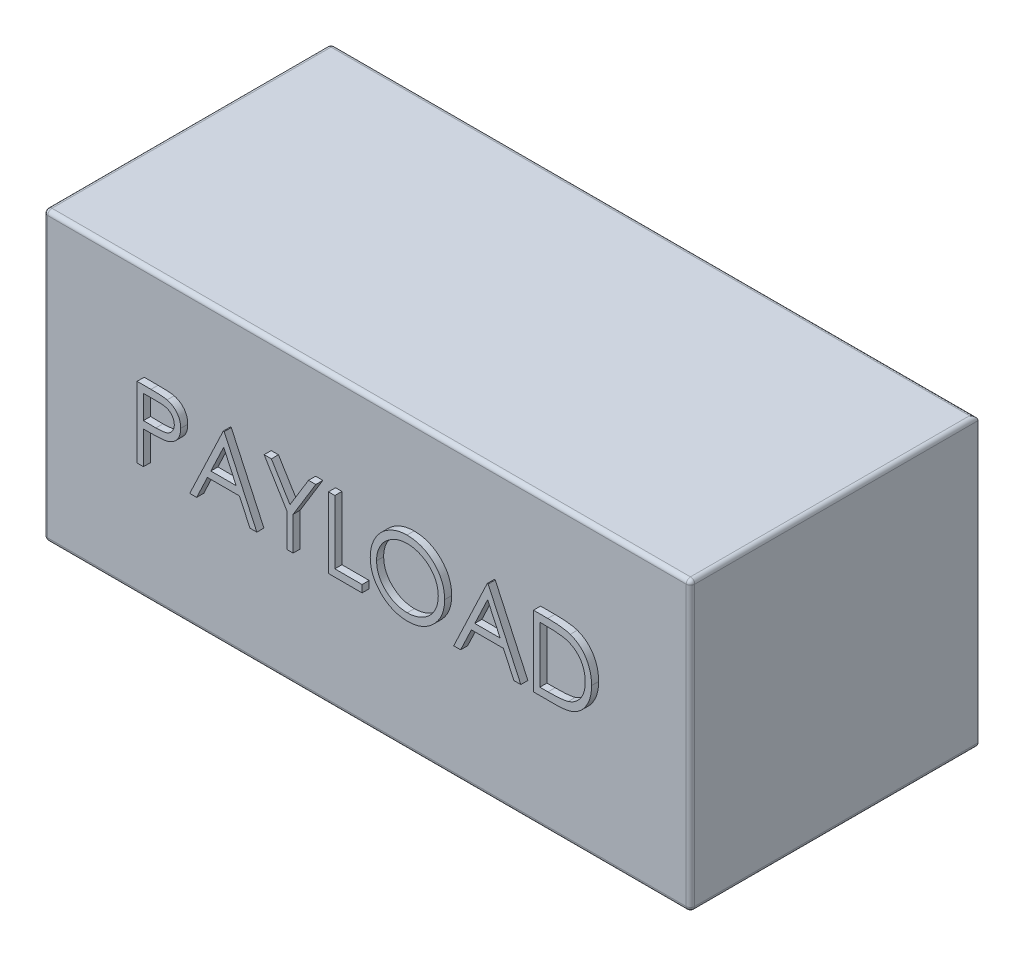
from build123d import *

# Parameters (mm, degrees)
SKETCH1_W           = 457.2
SKETCH1_H           = 203.2
BOSS_EXTRUDE1_DEPTH = 203.2
BOSS_EXTRUDE2_DEPTH = 5
BOSS_EXTRUDE3_DEPTH = 5
FILLET1_R           = 3


with BuildPart() as part:
    # Sketch1 → Boss-Extrude1 (new body)
    with BuildSketch(Plane.XY):
        Rectangle(SKETCH1_W, SKETCH1_H)
    extrude(amount=BOSS_EXTRUDE1_DEPTH)

    # Sketch2 → Boss-Extrude2 (add)
    # profile 1 of 7: a face of its own
    with BuildSketch(Plane.XZ.offset(101.6)):
        with BuildLine():
            Line((-154.356741259, 121.087426038), (-144.551052156, 121.087426038))
            add(Edge.make_bspline(
                [(-144.551052156, 121.087426038), (-143.87661064, 121.086684664), (-142.584350742, 121.085264156), (-140.731278518, 121.042196359), (-139.048282352, 120.984672186), (-137.538991196, 120.904930855), (-136.198761223, 120.810693851), (-135.033656944, 120.67852186), (-134.034520425, 120.540517638), (-133.435856861, 120.400211831), (-133.162831002, 120.336224115)],
                knots=[0, 0, 0, 0, 1.415646017, 2.712440637, 3.8905458, 4.950247383, 5.884950622, 6.709939814, 7.411656543, 8, 8, 8, 8], degree=3))
            add(Edge.make_bspline(
                [(-133.162831002, 120.336224115), (-132.817209091, 120.241624832), (-132.134109417, 120.054655379), (-131.149808801, 119.680173615), (-130.213325294, 119.236142684), (-129.321445888, 118.730086401), (-128.485130415, 118.140292626), (-127.691901258, 117.490669516), (-126.948758683, 116.766218536), (-126.259881656, 115.97506511), (-125.62724169, 115.130490683), (-125.082531937, 114.219887399), (-124.626428694, 113.258583064), (-124.235239101, 112.247246333), (-123.953689752, 111.177384569), (-123.741591184, 110.056431535), (-123.606967933, 108.884507389), (-123.594074193, 108.083652139), (-123.587510489, 107.675967705)],
                knots=[0, 0, 0, 0, 0.999701418, 1.975846123, 2.934577507, 3.890451536, 4.834027766, 5.787354733, 6.749476667, 7.726910423, 8.712836071, 9.690891519, 10.682875813, 11.679750201, 12.712814741, 13.765529915, 14.8625177, 16, 16, 16, 16], degree=3))
            add(Edge.make_bspline(
                [(-123.587510489, 107.675967705), (-123.593530843, 107.264856608), (-123.60531007, 106.46048998), (-123.746685575, 105.283735863), (-123.937116884, 104.159187433), (-124.229931917, 103.08933814), (-124.613441533, 102.080541419), (-125.063328002, 101.117380962), (-125.605949865, 100.216242792), (-126.229447432, 99.373855399), (-126.923041637, 98.58942808), (-127.683797897, 97.868645301), (-128.508644932, 97.215726181), (-129.394961334, 96.629206986), (-130.351387745, 96.122688707), (-131.363418511, 95.669012922), (-132.439850174, 95.28799777), (-133.184743231, 95.087568321), (-133.563472028, 94.985663218)],
                knots=[0, 0, 0, 0, 1.121902311, 2.195077645, 3.232258892, 4.234102512, 5.217864754, 6.176164875, 7.132989551, 8.084763148, 9.034132444, 9.988522005, 10.94243251, 11.903244335, 12.886203696, 13.894208494, 14.929344452, 16, 16, 16, 16], degree=3))
            add(Edge.make_bspline(
                [(-133.563472028, 94.985663218), (-133.876719656, 94.919049202), (-134.563220047, 94.773060715), (-135.693830364, 94.61008276), (-137.01019302, 94.470974178), (-138.510511305, 94.366672213), (-140.193438518, 94.277381235), (-142.059885051, 94.206408465), (-144.113514725, 94.167410553), (-145.545961069, 94.165399227), (-146.293840618, 94.164349115)],
                knots=[0, 0, 0, 0, 0.601384939, 1.31797006, 2.144135048, 3.087295005, 4.142315834, 5.309527816, 6.595305764, 8, 8, 8, 8], degree=3))
            Line((-146.293840618, 94.164349115), (-149.869561771, 94.164349115))
            Line((-149.869561771, 94.164349115), (-149.869561771, 71.087426038))
            Line((-149.869561771, 71.087426038), (-154.356741259, 71.087426038))
            Line((-154.356741259, 71.087426038), (-154.356741259, 121.087426038))
        make_face()
        with BuildLine():
            Line((-149.869561771, 115.95922091), (-149.869561771, 99.292554244))
            Line((-149.869561771, 99.292554244), (-141.115555361, 99.182377961))
            add(Edge.make_bspline(
                [(-141.115555361, 99.182377961), (-140.68812785, 99.182157053), (-139.862987851, 99.181730594), (-138.671041804, 99.238662358), (-137.565194843, 99.304384253), (-136.548843766, 99.400611731), (-135.621530416, 99.536629695), (-134.781708575, 99.673940237), (-134.035890248, 99.872588274), (-133.163044509, 100.14006069), (-132.190425259, 100.596240914), (-131.132317423, 101.2583822), (-130.235594761, 102.102392318), (-129.459619093, 103.051361336), (-128.843820837, 104.107063185), (-128.393020946, 105.236619424), (-128.12814727, 106.428445846), (-128.092630217, 107.243990687), (-128.074689977, 107.655935654)],
                knots=[0, 0, 0, 0, 1.160613943, 2.240541288, 3.23993089, 4.169200891, 5.011653406, 5.7853311, 6.478053781, 7.106038997, 8.262395093, 9.384106736, 10.481365981, 11.59014053, 12.70357646, 13.786202915, 14.881775077, 16, 16, 16, 16], degree=3))
            add(Edge.make_bspline(
                [(-128.074689977, 107.655935654), (-128.092727784, 108.057914417), (-128.128584712, 108.856998448), (-128.395097043, 110.0281236), (-128.842944383, 111.14577652), (-129.463752877, 112.188249167), (-130.21719759, 113.13380351), (-131.092902492, 113.955191039), (-132.088806225, 114.615501078), (-133.015209526, 115.041690816), (-133.838083612, 115.301909037), (-134.552825896, 115.483978186), (-135.359835531, 115.629343989), (-136.259375239, 115.747051172), (-137.244472865, 115.847814904), (-138.32359165, 115.916186007), (-139.492643696, 115.956206811), (-140.30422328, 115.958191886), (-140.724930361, 115.95922091)],
                knots=[0, 0, 0, 0, 1.120700087, 2.227813068, 3.331159281, 4.466773991, 5.599788987, 6.693661531, 7.80175334, 8.91857717, 9.525282508, 10.207424825, 10.974604443, 11.810962634, 12.737642355, 13.736264703, 14.826523623, 16, 16, 16, 16], degree=3))
            Line((-140.724930361, 115.95922091), (-149.869561771, 115.95922091))
        make_face(mode=Mode.SUBTRACT)
    # profile 2 of 7: a face of its own
    with BuildSketch(Plane.XZ.offset(101.6)):
        Polygon((-92.81827972, 121.087426038), (-69.741356643, 71.087426038), (-74.61916113, 71.087426038), (-82.010988053, 87.113067064), (-104.677254079, 87.113067064), (-112.279417541, 71.087426038), (-117.177254079, 71.087426038), (-93.459305361, 121.087426038), align=None)
        Polygon((-93.188872669, 111.34183309), (-102.243359848, 92.241272192), (-84.374770105, 92.241272192), align=None, mode=Mode.SUBTRACT)
    # profile 3 of 7: a face of its own
    with BuildSketch(Plane.XZ.offset(101.6)):
        Polygon((-64.613151515, 121.087426038), (-59.474930361, 121.087426038), (-46.33390472, 99.603051038), (-33.21291113, 121.087426038), (-28.074689977, 121.087426038), (-44.100331002, 94.855454885), (-44.100331002, 71.087426038), (-48.587510489, 71.087426038), (-48.587510489, 94.855454885), align=None)
    # profile 4 of 7: a face of its own
    with BuildSketch(Plane.XZ.offset(101.6)):
        Polygon((-19.100331002, 121.087426038), (-14.613151515, 121.087426038), (-14.613151515, 76.215631167), (4.617617716, 76.215631167), (4.617617716, 71.087426038), (-19.100331002, 71.087426038), align=None)
    # profile 5 of 7: a face of its own
    with BuildSketch(Plane.XZ.offset(101.6)):
        with BuildLine():
            add(Edge.make_bspline(
                [(36.348386947, 122.36947732), (37.274217031, 122.346027615), (39.092623702, 122.299970459), (41.765122241, 121.947411837), (44.316480745, 121.337477695), (46.767482728, 120.525149373), (49.088810964, 119.441515297), (51.297938, 118.131727463), (53.389607626, 116.582063767), (55.335627362, 114.804503383), (57.116440938, 112.870454042), (58.68538217, 110.806483898), (60.00027208, 108.625072436), (61.08006904, 106.332774856), (61.927192036, 103.934775313), (62.511749803, 101.41828956), (62.885151948, 98.799622559), (62.928805911, 97.013524491), (62.950951049, 96.10745809)],
                knots=[0, 0, 0, 0, 1.065120563, 2.091984664, 3.0946048, 4.079830382, 5.057816894, 6.036188127, 7.030412546, 8.04752943, 9.064399622, 10.05169764, 11.02544977, 11.989514704, 12.962713494, 13.945757189, 14.957906945, 16, 16, 16, 16], degree=3))
            add(Edge.make_bspline(
                [(62.950951049, 96.10745809), (62.928809156, 95.208065999), (62.885164919, 93.435259993), (62.51132524, 90.83321079), (61.925025241, 88.331915126), (61.087935724, 85.935548658), (60.013286031, 83.641583461), (58.689640729, 81.456055549), (57.130480576, 79.378248429), (55.35609699, 77.43092464), (53.42179639, 75.645246487), (51.347078292, 74.089262549), (49.178602293, 72.750346483), (46.888463605, 71.682008284), (44.507034508, 70.828123706), (42.013001321, 70.245943277), (39.418050549, 69.870414088), (37.64846478, 69.827292431), (36.749027972, 69.805374756)],
                knots=[0, 0, 0, 0, 1.043624062, 2.057103931, 3.04512605, 4.022047818, 4.998200453, 5.980619268, 6.982898556, 8.009068085, 9.034988726, 10.034168286, 11.015286542, 11.987931943, 12.962482838, 13.94673481, 14.956375938, 16, 16, 16, 16], degree=3))
            add(Edge.make_bspline(
                [(36.749027972, 69.805374756), (35.842966272, 69.827508854), (34.056877473, 69.871141053), (31.434919825, 70.245161122), (28.916666342, 70.83003689), (26.509318467, 71.665885979), (24.211533758, 72.746132132), (22.018818291, 74.063337548), (19.939973331, 75.626296707), (17.992234095, 77.400104916), (16.210102693, 79.331127087), (14.656397326, 81.400187874), (13.338895707, 83.566694398), (12.262276671, 85.836659028), (11.409927252, 88.199108209), (10.82842985, 90.669800745), (10.452201963, 93.234650828), (10.408847014, 94.980977947), (10.386848485, 95.867073474)],
                knots=[0, 0, 0, 0, 1.053102029, 2.075944431, 3.073151272, 4.055350789, 5.033113405, 6.020478099, 7.024410459, 8.052272461, 9.079885166, 10.07527673, 11.055994387, 12.023226415, 12.992069828, 13.970394897, 14.97016774, 16, 16, 16, 16], degree=3))
            add(Edge.make_bspline(
                [(10.386848485, 95.867073474), (10.394486135, 96.461825891), (10.409665083, 97.643827655), (10.592403547, 99.3990648), (10.857570707, 101.126074197), (11.237598029, 102.819944882), (11.734621843, 104.476530378), (12.321079377, 106.107255561), (13.037362882, 107.695594472), (13.847086426, 109.249071496), (14.75082654, 110.743470151), (15.749051532, 112.156035624), (16.806699653, 113.498621293), (17.966176705, 114.736435633), (19.189268779, 115.905487867), (20.495817039, 116.987812396), (21.877849101, 117.993168839), (23.341311669, 118.899173711), (24.850144167, 119.71858992), (26.405526707, 120.42175922), (27.986334871, 121.025274384), (29.599972699, 121.51442903), (31.242155157, 121.900600973), (32.916466365, 122.163563168), (34.621572455, 122.34676771), (35.770305583, 122.361874881), (36.348386947, 122.36947732)],
                knots=[0, 0, 0, 0, 1.037015668, 2.060948919, 3.074880161, 4.083647147, 5.086022904, 6.090072063, 7.104153813, 8.122640571, 9.144368836, 10.147691507, 11.138137339, 12.123020368, 13.103399296, 14.087645067, 15.080126199, 16.082011238, 17.087798457, 18.072939717, 19.057185487, 20.037253025, 21.01195951, 21.997135196, 22.992090687, 24, 24, 24, 24], degree=3))
        make_face()
        with BuildLine():
            add(Edge.make_bspline(
                [(36.568739511, 117.241272192), (36.094244746, 117.235488046), (35.149791418, 117.22397505), (33.745726615, 117.07232197), (32.36012756, 116.856180699), (30.9927081, 116.54787326), (29.649189681, 116.127815363), (28.317049092, 115.644373817), (27.008434037, 115.055501094), (25.727664639, 114.390176746), (24.486020708, 113.653763592), (23.314410688, 112.839881206), (22.209801488, 111.967616145), (21.174897679, 111.034932754), (20.212738076, 110.0370813), (19.304385198, 108.989189355), (18.486248318, 107.861305197), (17.736454363, 106.684013671), (17.065485216, 105.458848225), (16.468837292, 104.198707335), (15.980780023, 102.89331181), (15.582746076, 101.556823845), (15.252748778, 100.191360135), (15.04369272, 98.786562295), (14.890373299, 97.349489266), (14.879518364, 96.378319922), (14.874027972, 95.887105526)],
                knots=[0, 0, 0, 0, 1.008559885, 2.007477868, 2.99961109, 3.989939068, 4.984837346, 5.991145699, 7.001802488, 8.033829008, 9.059044045, 10.069351652, 11.065060232, 12.050310815, 13.029377138, 14.011219647, 14.996725999, 15.989392538, 16.977580475, 17.965360261, 18.951710183, 19.937753436, 20.929683414, 21.935841486, 22.955955122, 24, 24, 24, 24], degree=3))
            add(Edge.make_bspline(
                [(14.874027972, 95.887105526), (14.892240286, 95.164788086), (14.928069541, 93.743766225), (15.241749114, 91.661364169), (15.724920178, 89.660102936), (16.43716827, 87.750932803), (17.327891336, 85.917443048), (18.428275483, 84.175898696), (19.731976705, 82.525829062), (21.212884228, 80.978753791), (22.831780037, 79.566670873), (24.550819036, 78.327193607), (26.351584857, 77.278475752), (28.238773467, 76.424117575), (30.202309739, 75.747121321), (32.254846182, 75.283140876), (34.382709891, 74.977777228), (35.833147822, 74.948452143), (36.568739511, 74.933579885)],
                knots=[0, 0, 0, 0, 1.032063989, 2.030389145, 3.003944642, 3.970395727, 4.937377036, 5.913328081, 6.909231446, 7.93887556, 8.970685674, 9.976071282, 10.964166581, 11.944589148, 12.933237628, 13.927779006, 14.949070134, 16, 16, 16, 16], degree=3))
            add(Edge.make_bspline(
                [(36.568739511, 74.933579885), (37.063160962, 74.940372804), (38.043747196, 74.953845204), (39.502254658, 75.089540587), (40.934486254, 75.307138722), (42.33843311, 75.620433802), (43.712501844, 76.012536751), (45.062427603, 76.478361436), (46.37383175, 77.059521488), (47.663258005, 77.701635082), (48.897490029, 78.433637333), (50.075711919, 79.219896614), (51.168225916, 80.09087691), (52.202355508, 81.009702803), (53.168465351, 81.99490063), (54.060022268, 83.045189513), (54.874024156, 84.167198902), (55.623533394, 85.342704698), (56.292151433, 86.571222594), (56.874709991, 87.835932279), (57.368940217, 89.133719556), (57.767918857, 90.466456291), (58.08056831, 91.831611274), (58.295995737, 93.23101239), (58.446687718, 94.66186014), (58.458045963, 95.629629511), (58.463771562, 96.117474115)],
                knots=[0, 0, 0, 0, 1.047197238, 2.076906641, 3.100256066, 4.114471768, 5.12198147, 6.126382909, 7.136867548, 8.15857795, 9.17633901, 10.174870724, 11.156907918, 12.133735059, 13.104061851, 14.077631395, 15.04955518, 16.038496417, 17.029181396, 18.010275684, 18.986308667, 19.968651475, 20.955262928, 21.950658345, 22.966943676, 24, 24, 24, 24], degree=3))
            add(Edge.make_bspline(
                [(58.463771562, 96.117474115), (58.458041376, 96.601981319), (58.446674498, 97.563090607), (58.296067718, 98.983959441), (58.080340713, 100.373291034), (57.769444883, 101.725631076), (57.368728402, 103.041324292), (56.874623682, 104.319134973), (56.291976546, 105.563823474), (55.623287627, 106.772313431), (54.871633005, 107.931952545), (54.050286672, 109.040558439), (53.145067413, 110.077311886), (52.181838487, 111.067807515), (51.136540125, 111.990920224), (50.013907352, 112.846956233), (48.827569098, 113.656574437), (47.571465735, 114.386939607), (46.275123539, 115.061428645), (44.944924139, 115.639300119), (43.595937002, 116.130330396), (42.23159254, 116.549144182), (40.840407135, 116.854973184), (39.431781009, 117.072516754), (38.007663029, 117.223922266), (37.049902747, 117.235470531), (36.568739511, 117.241272192)],
                knots=[0, 0, 0, 0, 1.02996197, 2.043119294, 3.035359645, 4.018872909, 4.991431989, 5.957985074, 6.929999688, 7.912076566, 8.892894881, 9.867085534, 10.843653904, 11.817741046, 12.803660682, 13.806313499, 14.818574707, 15.856120519, 16.894564902, 17.924820532, 18.937903209, 19.946497019, 20.957711757, 21.963978472, 22.977135795, 24, 24, 24, 24], degree=3))
        make_face(mode=Mode.SUBTRACT)
    # profile 6 of 7: a face of its own
    with BuildSketch(Plane.XZ.offset(101.6)):
        Polygon((93.720181818, 121.087426038), (116.797104895, 71.087426038), (111.919300408, 71.087426038), (104.527473485, 87.113067064), (81.861207459, 87.113067064), (74.259043998, 71.087426038), (69.361207459, 71.087426038), (93.079156177, 121.087426038), align=None)
        Polygon((93.34958887, 111.34183309), (84.29510169, 92.241272192), (102.163691434, 92.241272192), align=None, mode=Mode.SUBTRACT)
    # profile 7 of 7: a face of its own
    with BuildSketch(Plane.XZ.offset(101.6)):
        with BuildLine():
            Line((125.77146387, 71.087426038), (125.77146387, 121.087426038))
            Line((125.77146387, 121.087426038), (135.867617716, 121.087426038))
            add(Edge.make_bspline(
                [(135.867617716, 121.087426038), (136.745746119, 121.08110361), (138.442285623, 121.068888711), (140.893892015, 120.991440266), (143.162231479, 120.854433611), (145.239843752, 120.654868952), (147.132432494, 120.409825615), (148.834698325, 120.102676981), (150.355443223, 119.739988833), (151.290720946, 119.430768115), (151.733002331, 119.284541423)],
                knots=[0, 0, 0, 0, 1.314313732, 2.53924729, 3.670748893, 4.714932338, 5.66265055, 6.526160246, 7.303039223, 8, 8, 8, 8], degree=3))
            add(Edge.make_bspline(
                [(151.733002331, 119.284541423), (152.311498607, 119.064102771), (153.455372782, 118.628224284), (155.084045962, 117.805991408), (156.617265433, 116.874375669), (158.063253217, 115.832149059), (159.388979308, 114.649801223), (160.646234976, 113.377557143), (161.783588173, 111.969152283), (162.825135259, 110.453795311), (163.764216109, 108.849337423), (164.580489792, 107.15883587), (165.258403983, 105.390875755), (165.821164363, 103.550373641), (166.264685185, 101.633282529), (166.567284209, 99.637370157), (166.766869779, 97.570524594), (166.786927655, 96.168032255), (166.797104895, 95.456416423)],
                knots=[0, 0, 0, 0, 0.984719456, 1.947108742, 2.898477687, 3.838006223, 4.779231079, 5.722358779, 6.681677486, 7.655904652, 8.64651281, 9.637519902, 10.640069247, 11.656948941, 12.698408672, 13.768548281, 14.867775369, 16, 16, 16, 16], degree=3))
            add(Edge.make_bspline(
                [(166.797104895, 95.456416423), (166.788119646, 94.83839873), (166.770413273, 93.620530317), (166.611423046, 91.82566038), (166.380332759, 90.084037932), (166.022558505, 88.403956503), (165.588236884, 86.770696247), (165.031606151, 85.201664185), (164.393956206, 83.682466909), (163.650386512, 82.233645824), (162.834081012, 80.86102622), (161.958056109, 79.567090104), (161.023246175, 78.370301221), (160.020737134, 77.267035334), (158.963484041, 76.258955643), (157.844565033, 75.337641138), (156.661092879, 74.521118926), (155.418368269, 73.777303094), (154.080137851, 73.128440873), (152.621054049, 72.579440733), (151.034894363, 72.124489084), (149.325552121, 71.744904859), (147.490073868, 71.443800535), (145.526660071, 71.241994929), (143.438327361, 71.105524462), (142.004337857, 71.093575985), (141.266255536, 71.087426038)],
                knots=[0, 0, 0, 0, 1.105936401, 2.179363191, 3.223086493, 4.248585256, 5.251745608, 6.245858792, 7.225916811, 8.198733463, 9.158002045, 10.082870192, 10.993790845, 11.873723703, 12.748670949, 13.606408763, 14.465103618, 15.319838547, 16.196477973, 17.123216899, 18.106603292, 19.147568657, 20.255746949, 21.433717677, 22.679120308, 24, 24, 24, 24], degree=3))
            Line((141.266255536, 71.087426038), (125.77146387, 71.087426038))
        make_face()
        with BuildLine():
            Line((130.258643357, 76.215631167), (135.997826049, 76.215631167))
            add(Edge.make_bspline(
                [(135.997826049, 76.215631167), (136.82251706, 76.219175401), (138.408699894, 76.22599226), (140.689528427, 76.285809448), (142.773519805, 76.383551412), (144.660969939, 76.520338238), (146.350813143, 76.701318455), (147.846580999, 76.90310278), (149.143370404, 77.154494934), (149.928076646, 77.382365782), (150.290694639, 77.487666423)],
                knots=[0, 0, 0, 0, 1.375205317, 2.645023457, 3.804390687, 4.853969522, 5.800190428, 6.637939096, 7.370582563, 8, 8, 8, 8], degree=3))
            add(Edge.make_bspline(
                [(150.290694639, 77.487666423), (150.747099811, 77.648402969), (151.649008928, 77.966036873), (152.947310145, 78.545432033), (154.158124498, 79.231747315), (155.30255343, 79.994636943), (156.364362794, 80.861008401), (157.356135884, 81.812022526), (158.275875903, 82.852519313), (159.114080303, 83.981207335), (159.864198932, 85.191061559), (160.513787924, 86.470187754), (161.083095518, 87.804570757), (161.529932555, 89.214701595), (161.880155186, 90.687973858), (162.128222157, 92.224491191), (162.282718221, 93.823966646), (162.300738906, 94.911854135), (162.309925408, 95.466432449)],
                knots=[0, 0, 0, 0, 0.998632004, 1.973411704, 2.929992603, 3.868527914, 4.809262121, 5.754881198, 6.702106254, 7.672490631, 8.653608572, 9.636854334, 10.631411391, 11.644891563, 12.686317036, 13.754757253, 14.855430412, 16, 16, 16, 16], degree=3))
            add(Edge.make_bspline(
                [(162.309925408, 95.466432449), (162.302592731, 96.051196453), (162.288187623, 97.199970515), (162.107126046, 98.885551876), (161.842532396, 100.506704027), (161.45990831, 102.063535389), (160.972324326, 103.559083278), (160.363829444, 104.98507628), (159.668592026, 106.356574407), (158.841401499, 107.641922489), (157.935464451, 108.857538334), (156.930066175, 109.971179985), (155.84117991, 110.985384275), (154.680682061, 111.915945884), (153.415866358, 112.725426968), (152.076527918, 113.449522412), (150.643018329, 114.064035146), (149.645694103, 114.390876042), (149.13885169, 114.55697732)],
                knots=[0, 0, 0, 0, 1.122418816, 2.205001699, 3.251619955, 4.274784885, 5.280384055, 6.268708349, 7.249350384, 8.229342522, 9.199999885, 10.157847722, 11.105861043, 12.055065948, 13.010012805, 13.98527497, 14.976112212, 16, 16, 16, 16], degree=3))
            add(Edge.make_bspline(
                [(149.13885169, 114.55697732), (148.719549599, 114.67292629), (147.827998309, 114.919465612), (146.373148823, 115.188399506), (144.735789546, 115.425606634), (142.908650958, 115.626435768), (140.893815828, 115.770540358), (138.689734571, 115.878701996), (136.295454506, 115.951653888), (134.635704023, 115.95663542), (133.774268357, 115.95922091)],
                knots=[0, 0, 0, 0, 0.674548936, 1.434276114, 2.292660221, 3.240891867, 4.284742987, 5.42552168, 6.663806718, 8, 8, 8, 8], degree=3))
            Line((133.774268357, 115.95922091), (130.258643357, 115.95922091))
            Line((130.258643357, 115.95922091), (130.258643357, 76.215631167))
        make_face(mode=Mode.SUBTRACT)
    extrude(amount=BOSS_EXTRUDE2_DEPTH)

    # Sketch3 → Boss-Extrude3 (add)
    # profile 1 of 7: a face of its own
    with BuildSketch(Plane.XY.offset(203.2)):
        with BuildLine():
            Line((-157.444672648, 33.74593702), (-147.638983545, 33.74593702))
            add(Edge.make_bspline(
                [(-147.638983545, 33.74593702), (-146.964542029, 33.745195645), (-145.672282132, 33.743775138), (-143.819209907, 33.700707341), (-142.136213741, 33.643183168), (-140.626922585, 33.563441837), (-139.286692612, 33.469204833), (-138.121588333, 33.337032842), (-137.122451814, 33.19902862), (-136.523788251, 33.058722812), (-136.250762392, 32.994735097)],
                knots=[0, 0, 0, 0, 1.415646017, 2.712440637, 3.8905458, 4.950247383, 5.884950622, 6.709939814, 7.411656543, 8, 8, 8, 8], degree=3))
            add(Edge.make_bspline(
                [(-136.250762392, 32.994735097), (-135.90514048, 32.900135814), (-135.222040806, 32.713166361), (-134.23774019, 32.338684597), (-133.301256683, 31.894653666), (-132.409377277, 31.388597382), (-131.573061805, 30.798803608), (-130.779832648, 30.149180498), (-130.036690072, 29.424729518), (-129.347813045, 28.633576092), (-128.71517308, 27.789001665), (-128.170463327, 26.87839838), (-127.714360083, 25.917094046), (-127.323170491, 24.905757315), (-127.041621141, 23.835895551), (-126.829522574, 22.714942517), (-126.694899322, 21.543018371), (-126.682005583, 20.742163121), (-126.675441879, 20.334478687)],
                knots=[0, 0, 0, 0, 0.999701418, 1.975846123, 2.934577507, 3.890451536, 4.834027766, 5.787354733, 6.749476667, 7.726910423, 8.712836071, 9.690891519, 10.682875813, 11.679750201, 12.712814741, 13.765529915, 14.8625177, 16, 16, 16, 16], degree=3))
            add(Edge.make_bspline(
                [(-126.675441879, 20.334478687), (-126.681462232, 19.92336759), (-126.69324146, 19.119000962), (-126.834616965, 17.942246845), (-127.025048273, 16.817698415), (-127.317863307, 15.747849122), (-127.701372922, 14.739052401), (-128.151259392, 13.775891944), (-128.693881254, 12.874753774), (-129.317378821, 12.03236638), (-130.010973027, 11.247939062), (-130.771729286, 10.527156283), (-131.596576322, 9.874237163), (-132.482892723, 9.287717967), (-133.439319135, 8.781199689), (-134.4513499, 8.327523904), (-135.527781563, 7.946508752), (-136.27267462, 7.746079303), (-136.651403417, 7.6441742)],
                knots=[0, 0, 0, 0, 1.121902311, 2.195077645, 3.232258892, 4.234102512, 5.217864754, 6.176164875, 7.132989551, 8.084763148, 9.034132444, 9.988522005, 10.94243251, 11.903244335, 12.886203696, 13.894208494, 14.929344452, 16, 16, 16, 16], degree=3))
            add(Edge.make_bspline(
                [(-136.651403417, 7.6441742), (-136.964651046, 7.577560184), (-137.651151437, 7.431571696), (-138.781761753, 7.268593741), (-140.09812441, 7.12948516), (-141.598442694, 7.025183195), (-143.281369907, 6.935892217), (-145.14781644, 6.864919447), (-147.201446114, 6.825921535), (-148.633892458, 6.823910209), (-149.381772007, 6.822860097)],
                knots=[0, 0, 0, 0, 0.601384939, 1.31797006, 2.144135048, 3.087295005, 4.142315834, 5.309527816, 6.595305764, 8, 8, 8, 8], degree=3))
            Line((-149.381772007, 6.822860097), (-152.957493161, 6.822860097))
            Line((-152.957493161, 6.822860097), (-152.957493161, -16.25406298))
            Line((-152.957493161, -16.25406298), (-157.444672648, -16.25406298))
            Line((-157.444672648, -16.25406298), (-157.444672648, 33.74593702))
        make_face()
        with BuildLine():
            Line((-152.957493161, 28.617731892), (-152.957493161, 11.951065225))
            Line((-152.957493161, 11.951065225), (-144.203486751, 11.840888943))
            add(Edge.make_bspline(
                [(-144.203486751, 11.840888943), (-143.776059239, 11.840668035), (-142.95091924, 11.840241576), (-141.758973194, 11.89717334), (-140.653126232, 11.962895235), (-139.636775156, 12.059122713), (-138.709461806, 12.195140677), (-137.869639965, 12.332451219), (-137.123821638, 12.531099256), (-136.250975898, 12.798571672), (-135.278356648, 13.254751896), (-134.220248812, 13.916893182), (-133.32352615, 14.760903299), (-132.547550482, 15.709872318), (-131.931752226, 16.765574167), (-131.480952336, 17.895130406), (-131.216078659, 19.086956828), (-131.180561607, 19.902501669), (-131.162621366, 20.314446636)],
                knots=[0, 0, 0, 0, 1.160613943, 2.240541288, 3.23993089, 4.169200891, 5.011653406, 5.7853311, 6.478053781, 7.106038997, 8.262395093, 9.384106736, 10.481365981, 11.59014053, 12.70357646, 13.786202915, 14.881775077, 16, 16, 16, 16], degree=3))
            add(Edge.make_bspline(
                [(-131.162621366, 20.314446636), (-131.180659173, 20.716425399), (-131.216516101, 21.51550943), (-131.483028432, 22.686634581), (-131.930875773, 23.804287501), (-132.551684266, 24.846760149), (-133.30512898, 25.792314492), (-134.180833881, 26.613702021), (-135.176737615, 27.27401206), (-136.103140915, 27.700201798), (-136.926015001, 27.960420018), (-137.640757285, 28.142489168), (-138.447766921, 28.287854971), (-139.347306628, 28.405562154), (-140.332404255, 28.506325886), (-141.411523039, 28.574696989), (-142.580575086, 28.614717793), (-143.392154669, 28.616702868), (-143.812861751, 28.617731892)],
                knots=[0, 0, 0, 0, 1.120700087, 2.227813068, 3.331159281, 4.466773991, 5.599788987, 6.693661531, 7.80175334, 8.91857717, 9.525282508, 10.207424825, 10.974604443, 11.810962634, 12.737642355, 13.736264703, 14.826523623, 16, 16, 16, 16], degree=3))
            Line((-143.812861751, 28.617731892), (-152.957493161, 28.617731892))
        make_face(mode=Mode.SUBTRACT)
    # profile 2 of 7: a face of its own
    with BuildSketch(Plane.XY.offset(203.2)):
        Polygon((-95.90621111, 33.74593702), (-72.829288033, -16.25406298), (-77.70709252, -16.25406298), (-85.098919443, -0.228421954), (-107.765185469, -0.228421954), (-115.36734893, -16.25406298), (-120.265185469, -16.25406298), (-96.547236751, 33.74593702), align=None)
        Polygon((-96.276804058, 24.000344071), (-105.331291238, 4.899783174), (-87.462701494, 4.899783174), align=None, mode=Mode.SUBTRACT)
    # profile 3 of 7: a face of its own
    with BuildSketch(Plane.XY.offset(203.2)):
        Polygon((-67.701082904, 33.74593702), (-62.562861751, 33.74593702), (-49.42183611, 12.26156202), (-36.30084252, 33.74593702), (-31.162621366, 33.74593702), (-47.188262392, 7.513965866), (-47.188262392, -16.25406298), (-51.675441879, -16.25406298), (-51.675441879, 7.513965866), align=None)
    # profile 4 of 7: a face of its own
    with BuildSketch(Plane.XY.offset(203.2)):
        Polygon((-22.188262392, 33.74593702), (-17.701082904, 33.74593702), (-17.701082904, -11.125857852), (1.529686326, -11.125857852), (1.529686326, -16.25406298), (-22.188262392, -16.25406298), align=None)
    # profile 5 of 7: a face of its own
    with BuildSketch(Plane.XY.offset(203.2)):
        with BuildLine():
            add(Edge.make_bspline(
                [(33.260455557, 35.027988302), (34.186285641, 35.004538597), (36.004692312, 34.958481441), (38.677190851, 34.605922819), (41.228549355, 33.995988676), (43.679551338, 33.183660355), (46.000879575, 32.100026278), (48.21000661, 30.790238445), (50.301676237, 29.240574748), (52.247695973, 27.463014365), (54.028509548, 25.528965023), (55.597450781, 23.464994879), (56.912340691, 21.283583418), (57.99213765, 18.991285837), (58.839260646, 16.593286295), (59.423818413, 14.076800541), (59.797220558, 11.45813354), (59.840874521, 9.672035473), (59.86301966, 8.765969071)],
                knots=[0, 0, 0, 0, 1.065120563, 2.091984664, 3.0946048, 4.079830382, 5.057816894, 6.036188127, 7.030412546, 8.04752943, 9.064399622, 10.05169764, 11.02544977, 11.989514704, 12.962713494, 13.945757189, 14.957906945, 16, 16, 16, 16], degree=3))
            add(Edge.make_bspline(
                [(59.86301966, 8.765969071), (59.840877766, 7.866576981), (59.79723353, 6.093770974), (59.423393851, 3.491721772), (58.837093851, 0.990426108), (58.000004334, -1.40594036), (56.925354642, -3.699905557), (55.60170934, -5.885433469), (54.042549187, -7.963240589), (52.2681656, -9.910564378), (50.333865, -11.696242531), (48.259146903, -13.252226469), (46.090670904, -14.591142535), (43.800532216, -15.659480734), (41.419103118, -16.513365312), (38.925069932, -17.095545741), (36.330119159, -17.471074931), (34.560533391, -17.514196587), (33.661096583, -17.536114262)],
                knots=[0, 0, 0, 0, 1.043624062, 2.057103931, 3.04512605, 4.022047818, 4.998200453, 5.980619268, 6.982898556, 8.009068085, 9.034988726, 10.034168286, 11.015286542, 11.987931943, 12.962482838, 13.94673481, 14.956375938, 16, 16, 16, 16], degree=3))
            add(Edge.make_bspline(
                [(33.661096583, -17.536114262), (32.755034883, -17.513980164), (30.968946084, -17.470347965), (28.346988436, -17.096327896), (25.828734952, -16.511452128), (23.421387078, -15.675603039), (21.123602369, -14.595356886), (18.930886902, -13.278151471), (16.852041941, -11.715192311), (14.904302706, -9.941384103), (13.122171303, -8.010361931), (11.568465936, -5.941301144), (10.250964317, -3.774794621), (9.174345282, -1.50482999), (8.321995863, 0.857619191), (7.740498461, 3.328311727), (7.364270574, 5.89316181), (7.320915624, 7.639488929), (7.298917096, 8.525584456)],
                knots=[0, 0, 0, 0, 1.053102029, 2.075944431, 3.073151272, 4.055350789, 5.033113405, 6.020478099, 7.024410459, 8.052272461, 9.079885166, 10.07527673, 11.055994387, 12.023226415, 12.992069828, 13.970394897, 14.97016774, 16, 16, 16, 16], degree=3))
            add(Edge.make_bspline(
                [(7.298917096, 8.525584456), (7.306554746, 9.120336872), (7.321733693, 10.302338637), (7.504472157, 12.057575782), (7.769639317, 13.784585178), (8.149666639, 15.478455864), (8.646690454, 17.135041359), (9.233147988, 18.765766543), (9.949431493, 20.354105453), (10.759155036, 21.907582478), (11.662895151, 23.401981133), (12.661120143, 24.814546606), (13.718768264, 26.157132275), (14.878245316, 27.394946615), (16.10133739, 28.563998849), (17.407885649, 29.646323378), (18.789917711, 30.65167982), (20.25338028, 31.557684693), (21.762212778, 32.377100902), (23.317595318, 33.080270201), (24.898403482, 33.683785366), (26.512041309, 34.172940012), (28.154223768, 34.559111954), (29.828534976, 34.82207415), (31.533641066, 35.005278691), (32.682374193, 35.020385863), (33.260455557, 35.027988302)],
                knots=[0, 0, 0, 0, 1.037015668, 2.060948919, 3.074880161, 4.083647147, 5.086022904, 6.090072063, 7.104153813, 8.122640571, 9.144368836, 10.147691507, 11.138137339, 12.123020368, 13.103399296, 14.087645067, 15.080126199, 16.082011238, 17.087798457, 18.072939717, 19.057185487, 20.037253025, 21.01195951, 21.997135196, 22.992090687, 24, 24, 24, 24], degree=3))
        make_face()
        with BuildLine():
            add(Edge.make_bspline(
                [(33.480808121, 29.899783174), (33.006313356, 29.893999028), (32.061860029, 29.882486031), (30.657795225, 29.730832952), (29.27219617, 29.514691681), (27.904776711, 29.206384241), (26.561258291, 28.786326345), (25.229117703, 28.302884799), (23.920502648, 27.714012076), (22.63973325, 27.048687728), (21.398089319, 26.312274574), (20.226479298, 25.498392187), (19.121870099, 24.626127127), (18.086966289, 23.693443736), (17.124806687, 22.695592282), (16.216453809, 21.647700337), (15.398316928, 20.519816179), (14.648522974, 19.342524653), (13.977553827, 18.117359207), (13.380905902, 16.857218317), (12.892848634, 15.551822792), (12.494814687, 14.215334826), (12.164817389, 12.849871117), (11.95576133, 11.445073276), (11.80244191, 10.008000247), (11.791586975, 9.036830904), (11.786096583, 8.545616507)],
                knots=[0, 0, 0, 0, 1.008559885, 2.007477868, 2.99961109, 3.989939068, 4.984837346, 5.991145699, 7.001802488, 8.033829008, 9.059044045, 10.069351652, 11.065060232, 12.050310815, 13.029377138, 14.011219647, 14.996725999, 15.989392538, 16.977580475, 17.965360261, 18.951710183, 19.937753436, 20.929683414, 21.935841486, 22.955955122, 24, 24, 24, 24], degree=3))
            add(Edge.make_bspline(
                [(11.786096583, 8.545616507), (11.804308896, 7.823299067), (11.840138152, 6.402277206), (12.153817725, 4.319875151), (12.636988788, 2.318613917), (13.34923688, 0.409443785), (14.239959947, -1.42404597), (15.340344094, -3.165590323), (16.644045316, -4.815659956), (18.124952839, -6.362735227), (19.743848647, -7.774818145), (21.462887646, -9.014295412), (23.263653468, -10.063013266), (25.150842078, -10.917371443), (27.11437835, -11.594367697), (29.166914793, -12.058348142), (31.294778501, -12.36371179), (32.745216432, -12.393036875), (33.480808121, -12.407909134)],
                knots=[0, 0, 0, 0, 1.032063989, 2.030389145, 3.003944642, 3.970395727, 4.937377036, 5.913328081, 6.909231446, 7.93887556, 8.970685674, 9.976071282, 10.964166581, 11.944589148, 12.933237628, 13.927779006, 14.949070134, 16, 16, 16, 16], degree=3))
            add(Edge.make_bspline(
                [(33.480808121, -12.407909134), (33.975229573, -12.401116214), (34.955815807, -12.387643815), (36.414323269, -12.251948431), (37.846554865, -12.034350297), (39.25050172, -11.721055217), (40.624570455, -11.328952268), (41.974496213, -10.863127582), (43.285900361, -10.28196753), (44.575326615, -9.639853936), (45.809558639, -8.907851685), (46.987780529, -8.121592404), (48.080294527, -7.250612109), (49.114424119, -6.331786215), (50.080533962, -5.346588389), (50.972090879, -4.296299505), (51.786092767, -3.174290116), (52.535602004, -1.99878432), (53.204220044, -0.770266424), (53.786778601, 0.494443261), (54.281008828, 1.792230537), (54.679987468, 3.124967273), (54.992636921, 4.490122255), (55.208064348, 5.889523372), (55.358756329, 7.320371122), (55.370114574, 8.288140493), (55.375840172, 8.775985097)],
                knots=[0, 0, 0, 0, 1.047197238, 2.076906641, 3.100256066, 4.114471768, 5.12198147, 6.126382909, 7.136867548, 8.15857795, 9.17633901, 10.174870724, 11.156907918, 12.133735059, 13.104061851, 14.077631395, 15.04955518, 16.038496417, 17.029181396, 18.010275684, 18.986308667, 19.968651475, 20.955262928, 21.950658345, 22.966943676, 24, 24, 24, 24], degree=3))
            add(Edge.make_bspline(
                [(55.375840172, 8.775985097), (55.370109987, 9.260492301), (55.358743109, 10.221601589), (55.208136328, 11.642470423), (54.992409323, 13.031802015), (54.681513494, 14.384142058), (54.280797012, 15.699835273), (53.786692292, 16.977645955), (53.204045157, 18.222334456), (52.535356237, 19.430824413), (51.783701616, 20.590463527), (50.962355283, 21.69906942), (50.057136024, 22.735822868), (49.093907097, 23.726318497), (48.048608735, 24.649431206), (46.925975963, 25.505467215), (45.739637709, 26.315085419), (44.483534346, 27.045450588), (43.18719215, 27.719939627), (41.85699275, 28.297811101), (40.508005613, 28.788841378), (39.143661151, 29.207655164), (37.752475746, 29.513484166), (36.343849619, 29.731027735), (34.91973164, 29.882433248), (33.961971358, 29.893981513), (33.480808121, 29.899783174)],
                knots=[0, 0, 0, 0, 1.02996197, 2.043119294, 3.035359645, 4.018872909, 4.991431989, 5.957985074, 6.929999688, 7.912076566, 8.892894881, 9.867085534, 10.843653904, 11.817741046, 12.803660682, 13.806313499, 14.818574707, 15.856120519, 16.894564902, 17.924820532, 18.937903209, 19.946497019, 20.957711757, 21.963978472, 22.977135795, 24, 24, 24, 24], degree=3))
        make_face(mode=Mode.SUBTRACT)
    # profile 6 of 7: a face of its own
    with BuildSketch(Plane.XY.offset(203.2)):
        Polygon((90.632250429, 33.74593702), (113.709173506, -16.25406298), (108.831369019, -16.25406298), (101.439542096, -0.228421954), (78.77327607, -0.228421954), (71.171112608, -16.25406298), (66.27327607, -16.25406298), (89.991224788, 33.74593702), align=None)
        Polygon((90.26165748, 24.000344071), (81.207170301, 4.899783174), (99.075760044, 4.899783174), align=None, mode=Mode.SUBTRACT)
    # profile 7 of 7: a face of its own
    with BuildSketch(Plane.XY.offset(203.2)):
        with BuildLine():
            Line((122.68353248, -16.25406298), (122.68353248, 33.74593702))
            Line((122.68353248, 33.74593702), (132.779686326, 33.74593702))
            add(Edge.make_bspline(
                [(132.779686326, 33.74593702), (133.657814729, 33.739614592), (135.354354234, 33.727399693), (137.805960626, 33.649951248), (140.07430009, 33.512944593), (142.151912362, 33.313379934), (144.044501105, 33.068336596), (145.746766935, 32.761187963), (147.267511834, 32.398499814), (148.202789557, 32.089279097), (148.645070942, 31.943052405)],
                knots=[0, 0, 0, 0, 1.314313732, 2.53924729, 3.670748893, 4.714932338, 5.66265055, 6.526160246, 7.303039223, 8, 8, 8, 8], degree=3))
            add(Edge.make_bspline(
                [(148.645070942, 31.943052405), (149.223567218, 31.722613753), (150.367441393, 31.286735266), (151.996114573, 30.46450239), (153.529334044, 29.53288665), (154.975321827, 28.49066004), (156.301047919, 27.308312205), (157.558303587, 26.036068125), (158.695656784, 24.627663264), (159.73720387, 23.112306293), (160.676284719, 21.507848404), (161.492558403, 19.817346852), (162.170472593, 18.049386737), (162.733232973, 16.208884622), (163.176753795, 14.291793511), (163.47935282, 12.295881138), (163.678938389, 10.229035576), (163.698996265, 8.826543237), (163.709173506, 8.114927405)],
                knots=[0, 0, 0, 0, 0.984719456, 1.947108742, 2.898477687, 3.838006223, 4.779231079, 5.722358779, 6.681677486, 7.655904652, 8.64651281, 9.637519902, 10.640069247, 11.656948941, 12.698408672, 13.768548281, 14.867775369, 16, 16, 16, 16], degree=3))
            add(Edge.make_bspline(
                [(163.709173506, 8.114927405), (163.700188256, 7.496909712), (163.682481883, 6.279041299), (163.523491656, 4.484171361), (163.29240137, 2.742548914), (162.934627115, 1.062467484), (162.500305495, -0.570792771), (161.943674762, -2.139824833), (161.306024817, -3.659022109), (160.562455123, -5.107843194), (159.746149623, -6.480462799), (158.87012472, -7.774398915), (157.935314786, -8.971187798), (156.932805744, -10.074453684), (155.875552652, -11.082533375), (154.756633644, -12.00384788), (153.57316149, -12.820370092), (152.330436879, -13.564185924), (150.992206462, -14.213048146), (149.533122659, -14.762048286), (147.946962974, -15.216999934), (146.237620732, -15.59658416), (144.402142479, -15.897688483), (142.438728681, -16.099494089), (140.350395971, -16.235964556), (138.916406468, -16.247913033), (138.178324147, -16.25406298)],
                knots=[0, 0, 0, 0, 1.105936401, 2.179363191, 3.223086493, 4.248585256, 5.251745608, 6.245858792, 7.225916811, 8.198733463, 9.158002045, 10.082870192, 10.993790845, 11.873723703, 12.748670949, 13.606408763, 14.465103618, 15.319838547, 16.196477973, 17.123216899, 18.106603292, 19.147568657, 20.255746949, 21.433717677, 22.679120308, 24, 24, 24, 24], degree=3))
            Line((138.178324147, -16.25406298), (122.68353248, -16.25406298))
        make_face()
        with BuildLine():
            Line((127.170711967, -11.125857852), (132.90989466, -11.125857852))
            add(Edge.make_bspline(
                [(132.90989466, -11.125857852), (133.73458567, -11.122313618), (135.320768505, -11.115496758), (137.601597037, -11.05567957), (139.685588416, -10.957937606), (141.57303855, -10.82115078), (143.262881754, -10.640170563), (144.758649609, -10.438386238), (146.055439014, -10.186994085), (146.840145256, -9.959123236), (147.202763249, -9.853822595)],
                knots=[0, 0, 0, 0, 1.375205317, 2.645023457, 3.804390687, 4.853969522, 5.800190428, 6.637939096, 7.370582563, 8, 8, 8, 8], degree=3))
            add(Edge.make_bspline(
                [(147.202763249, -9.853822595), (147.659168422, -9.693086049), (148.561077539, -9.375452145), (149.859378756, -8.796056986), (151.070193108, -8.109741703), (152.214622041, -7.346852075), (153.276431404, -6.480480618), (154.268204494, -5.529466492), (155.187944514, -4.488969705), (156.026148914, -3.360281683), (156.776267543, -2.150427459), (157.425856534, -0.871301264), (157.995164128, 0.463081739), (158.442001166, 1.873212577), (158.792223797, 3.34648484), (159.040290768, 4.883002172), (159.194786831, 6.482477627), (159.212807516, 7.570365117), (159.221994019, 8.12494343)],
                knots=[0, 0, 0, 0, 0.998632004, 1.973411704, 2.929992603, 3.868527914, 4.809262121, 5.754881198, 6.702106254, 7.672490631, 8.653608572, 9.636854334, 10.631411391, 11.644891563, 12.686317036, 13.754757253, 14.855430412, 16, 16, 16, 16], degree=3))
            add(Edge.make_bspline(
                [(159.221994019, 8.12494343), (159.214661342, 8.709707435), (159.200256234, 9.858481497), (159.019194656, 11.544062858), (158.754601006, 13.165215008), (158.37197692, 14.722046371), (157.884392937, 16.217594259), (157.275898054, 17.643587262), (156.580660636, 19.015085389), (155.75347011, 20.300433471), (154.847533062, 21.516049316), (153.842134786, 22.629690967), (152.753248521, 23.643895256), (151.592750672, 24.574456866), (150.327934968, 25.38393795), (148.988596528, 26.108033394), (147.55508694, 26.722546128), (146.557762714, 27.049387024), (146.050920301, 27.215488302)],
                knots=[0, 0, 0, 0, 1.122418816, 2.205001699, 3.251619955, 4.274784885, 5.280384055, 6.268708349, 7.249350384, 8.229342522, 9.199999885, 10.157847722, 11.105861043, 12.055065948, 13.010012805, 13.98527497, 14.976112212, 16, 16, 16, 16], degree=3))
            add(Edge.make_bspline(
                [(146.050920301, 27.215488302), (145.63161821, 27.331437272), (144.74006692, 27.577976594), (143.285217434, 27.846910487), (141.647858156, 28.084117616), (139.820719569, 28.28494675), (137.805884439, 28.42905134), (135.601803182, 28.537212978), (133.207523117, 28.61016487), (131.547772633, 28.615146402), (130.686336967, 28.617731892)],
                knots=[0, 0, 0, 0, 0.674548936, 1.434276114, 2.292660221, 3.240891867, 4.284742987, 5.42552168, 6.663806718, 8, 8, 8, 8], degree=3))
            Line((130.686336967, 28.617731892), (127.170711967, 28.617731892))
            Line((127.170711967, 28.617731892), (127.170711967, -11.125857852))
        make_face(mode=Mode.SUBTRACT)
    extrude(amount=BOSS_EXTRUDE3_DEPTH)

    # Fillet1
    fillet1_edges = [part.edges().sort_by_distance(p)[0] for p in [
        (-228.6, 0, 0),
        (-228.6, 101.6, 101.6),
        (0, 101.6, 0),
        (0, 101.6, 203.2),
        (228.6, 101.6, 101.6),
        (228.6, 0, 203.2),
        (228.6, -101.6, 101.6),
        (0, -101.6, 0),
        (-228.6, -101.6, 101.6),
        (-228.6, 0, 203.2),
        (0, -101.6, 203.2),
    ]]
    fillet(fillet1_edges, radius=FILLET1_R)


solid = part.part
